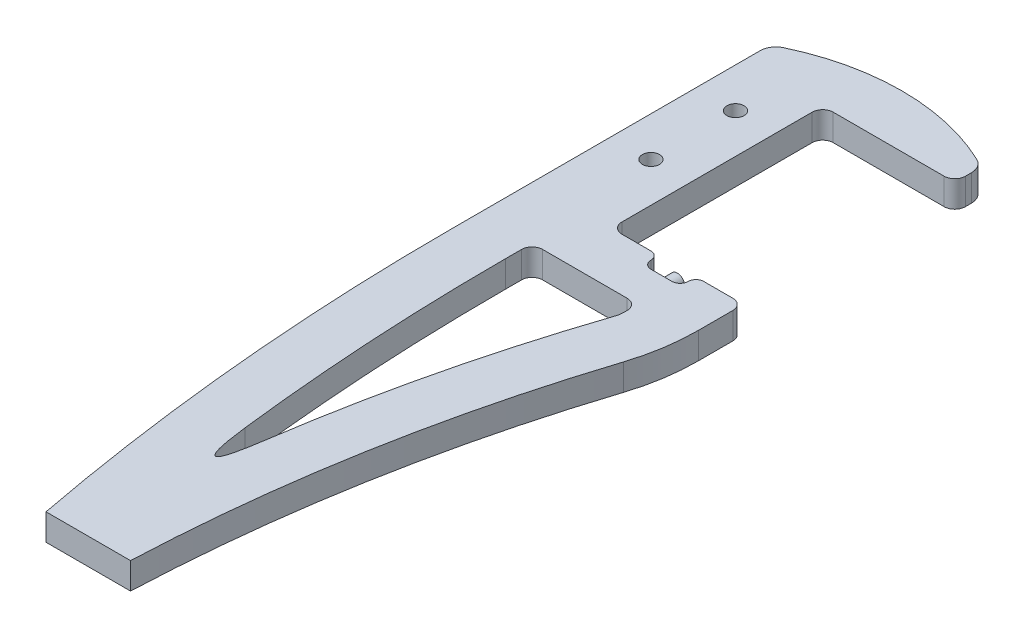
from build123d import *

# Parameters (mm, degrees)
BOSS_EXTRUDE1_DEPTH = 5
SKETCH2_R           = 1.625
CUT_EXTRUDE1_DEPTH  = 5
SKETCH3_W           = 7
SKETCH3_H           = 3
CUT_EXTRUDE2_DEPTH  = 5
SKETCH4_R           = 1.375
BOSS_EXTRUDE2_DEPTH = 3
CUT_EXTRUDE3_DEPTH  = 5
FILLET1_R           = 2
FILLET2_R           = 4
FILLET3_R           = 40
FILLET5_R           = 2
FILLET6_R           = 2
FILLET7_R           = 3
FILLET10_R          = 1.5


# Some blends are built 0.0001 mm under size
with BuildPart() as part:
    # Sketch1 → Boss-Extrude1 (new body)
    with BuildSketch(Plane(origin=(0, 0, 0), x_dir=(1, 0, 0), z_dir=(0, 1, 0))):
        with BuildLine():
            Line((0, 145), (0, 85))
            ThreePointArc((0, 85), (1.979630786, 42.309847603), (8, 0))
            Line((8, 0), (24, 0))
            ThreePointArc((24, 0), (28.920632518, 43.079645644), (40, 85))
            Line((40, 85), (40, 100))
            Line((40, 100), (15, 100))
            Line((15, 100), (15, 140))
            Line((15, 140), (40, 140))
            Line((40, 140), (40, 145))
            ThreePointArc((40, 145), (20, 150), (0, 145))
        make_face()
    extrude(amount=BOSS_EXTRUDE1_DEPTH)

    # Sketch2 → Cut-Extrude1 (cut)
    with BuildSketch(Plane(origin=(0, 5, 0), x_dir=(1, 0, 0), z_dir=(0, 1, 0))):
        with Locations(Location((7.5, 131, 0), (0, 0, 270))):
            Circle(SKETCH2_R)
        with Locations(Location((7.5, 115, 0), (0, 0, 270))):
            Circle(SKETCH2_R)
    extrude(amount=-CUT_EXTRUDE1_DEPTH, mode=Mode.SUBTRACT)

    # Sketch3 → Cut-Extrude2 (cut)
    with BuildSketch(Plane(origin=(0, 5, 0), x_dir=(1, 0, 0), z_dir=(0, 1, 0))):
        with Locations((27.5, 98.5)):
            Rectangle(SKETCH3_W, SKETCH3_H)
    extrude(amount=-CUT_EXTRUDE2_DEPTH, mode=Mode.SUBTRACT)

    # Sketch4 → Boss-Extrude2 (add)
    with BuildSketch(Plane(origin=(0, 0, -97), x_dir=(-1, 0, 0), z_dir=(0, 0, -1))):
        with Locations(Location((-27.5, 2.5, 0), (0, 0, 180))):
            Circle(SKETCH4_R)
    extrude(amount=BOSS_EXTRUDE2_DEPTH)

    # Sketch5 → Cut-Extrude3 (cut)
    with BuildSketch(Plane(origin=(0, 5, 0), x_dir=(1, 0, 0), z_dir=(0, 1, 0))):
        with BuildLine():
            Line((14, 90), (30, 90))
            Line((30, 90), (30, 87))
            Line((30, 87), (30, 86.654767806))
            ThreePointArc((30, 86.654767806), (20.590082312, 52.378278053), (15.165707783, 17.249935341))
            ThreePointArc((15.165707783, 17.249935341), (11.273342316, 51.022188328), (10, 84.994150003))
            Line((10, 84.994150003), (10, 90))
            Line((10, 90), (14, 90))
        make_face()
    extrude(amount=-CUT_EXTRUDE3_DEPTH, mode=Mode.SUBTRACT)

    # Fillet1
    fillet1_edges = [part.edges().sort_by_distance(p)[0] for p in [
        (10, 2.5, -90),
        (30, 2.5, -90),
    ]]
    fillet(fillet1_edges, radius=FILLET1_R)

    # Fillet2
    fillet2_edges = [part.edges().sort_by_distance(p)[0] for p in [
        (30, 2.5, -86.654767806),
    ]]
    fillet(fillet2_edges, radius=FILLET2_R)

    # Fillet3
    fillet3_edges = [part.edges().sort_by_distance(p)[0] for p in [
        (40, 2.5, -85),
    ]]
    fillet(fillet3_edges, radius=FILLET3_R)

    # Fillet5
    fillet5_edges = [part.edges().sort_by_distance(p)[0] for p in [
        (15, 2.5, -140),
        (15, 2.5, -100),
    ]]
    fillet(fillet5_edges, radius=FILLET5_R)

    # Fillet6
    fillet6_edges = [part.edges().sort_by_distance(p)[0] for p in [
        (40, 2.5, -140),
        (40, 2.5, -100),
    ]]
    fillet(fillet6_edges, radius=FILLET6_R)

    # Fillet7
    fillet7_edges = [part.edges().sort_by_distance(p)[0] for p in [
        (40, 2.5, -145),
        (0, 2.5, -145),
    ]]
    fillet(fillet7_edges, radius=FILLET7_R)

    # Fillet8
    # a fillet whose section is not a circle: 2 mm, written as the material it adds along each edge
    with BuildSketch(Plane(origin=(15.165707783, 5, -17.249935341), x_dir=(0.12048141281398392, 0, -0.9927155832192553), z_dir=(0, -1, 0))) as fillet8_piece_1:
        with BuildLine():
            Bezier((15.455336501, 0), (0.383468278, -0.375827748), (15.032037076, -3.942603658), weights=[1, 1, 1])
            ThreePointArc((15.032037076, -3.942603658), (7.498610953, -2.037672046), (0, 0))
            ThreePointArc((0, 0), (7.72766825, -0.096332478), (15.455336501, 0))
        make_face()
    extrude(amount=5)

    # Fillet10
    fillet10_edges = [part.edges().sort_by_distance(p)[0] for p in [
        (31, 2.5, -97),
        (24, 2.5, -97),
    ]]
    fillet(fillet10_edges, radius=FILLET10_R)
    fillet10_2_edges = [part.edges().sort_by_distance(p)[0] for p in [
        (31, 2.5, -100),
        (24, 2.5, -100),
    ]]
    fillet(fillet10_2_edges, radius=FILLET10_R - 0.0001)  # a hair under: the kernel refuses the full size


solid = part.part
